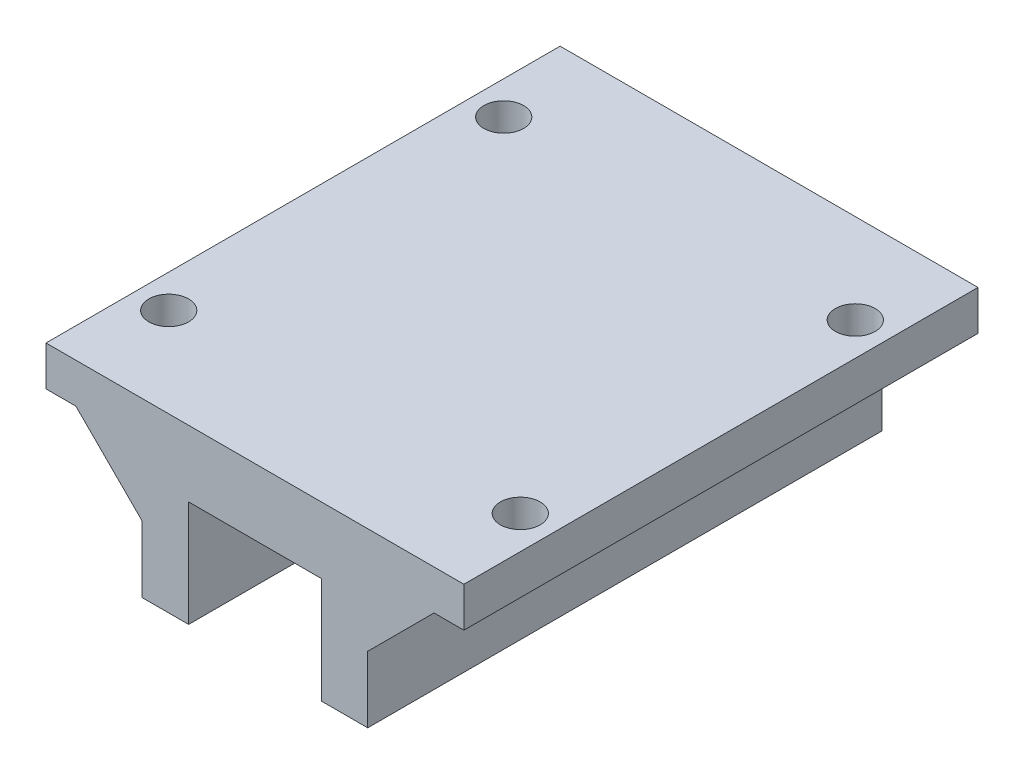
from build123d import *

# Parameters (mm, degrees)
Y_KSEKLIK_EKSTR_ZYON1_DEPTH = 77.5
KES_EKSTR_ZYON1_START       = 7.992125884
KES_EKSTR_ZYON1_OUTLINE_R   = 3
KES_EKSTR_ZYON1_DEPTH       = 9.5000001


# Read off the part's stored shape, not the designer's step: Kes-Ekstrüzyon1
with BuildPart() as part:
    # Çizim1 → Yükseklik-Ekstrüzyon1 (new body)
    with BuildSketch(Plane.XY):
        Polygon((-33.046021585, 17.492125984), (29.953978415, 17.492125984), (29.953978415, 11.492125984), (25.453978415, 11.492125984), (15.453978415, 1.492125984), (15.453978415, -8.507874016), (8.453978415, -8.507874016), (8.453978415, 7.492125984), (-11.546021585, 7.492125984), (-11.546021585, -8.507874016), (-18.546021585, -8.507874016), (-18.546021585, 1.492125984), (-28.546021585, 11.492125984), (-33.046021585, 11.492125984), align=None)
    extrude(amount=Y_KSEKLIK_EKSTR_ZYON1_DEPTH)

    # Kes-Ekstrüzyon1 outline → Kes-Ekstrüzyon1 (cut)
    with BuildSketch(Plane(origin=(0, 0, 0), x_dir=(1, 0, 0), z_dir=(0, 1, 0)).offset(KES_EKSTR_ZYON1_START)):
        with Locations((-28.046021585, -13.5)):
            Circle(KES_EKSTR_ZYON1_OUTLINE_R)
        with Locations((24.953978415, -64)):
            Circle(KES_EKSTR_ZYON1_OUTLINE_R)
        with Locations((-28.046021585, -64)):
            Circle(KES_EKSTR_ZYON1_OUTLINE_R)
        with Locations((24.953978415, -13.5)):
            Circle(KES_EKSTR_ZYON1_OUTLINE_R)
    extrude(amount=KES_EKSTR_ZYON1_DEPTH, mode=Mode.SUBTRACT)


solid = part.part
